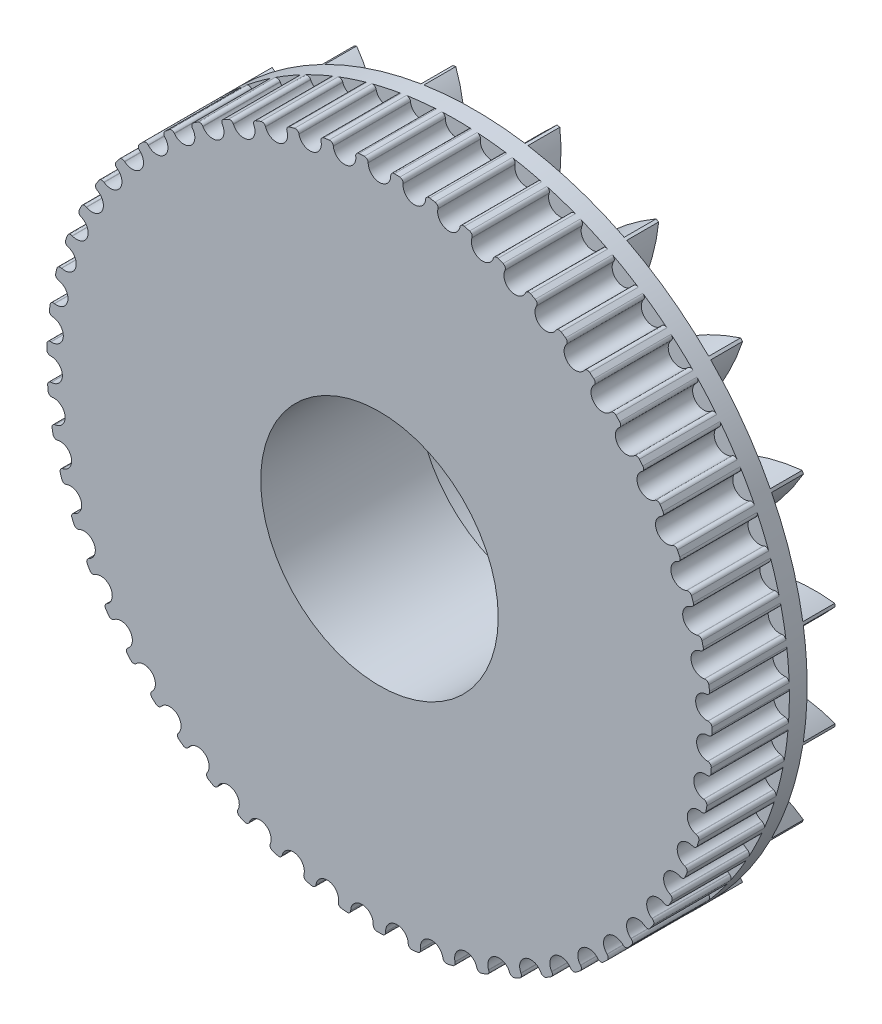
from build123d import *
from build123d.topology import SkipClean

# Parameters (mm, degrees)
KREISMUSTER1_COUNT              = 20
SKIZZE5_R                       = 28.00751142892637
AUFSATZ_LINEAR_AUSTRAGEN1_DEPTH = 8
SCHNITT_LINEAR_START            = -6.5
SCHNITT_LINEAR_AUSTRAGEN3_DEPTH = 6.5
VERRUNDUNG1_R                   = 0.3
KREISMUSTER4_COUNT              = 59
VERRUNDUNG1_OF_KREISMUSTER4_R   = 0.3
SKIZZE9_R                       = 10
SCHNITT_LINEAR_AUSTRAGEN4_DEPTH = 42.023846827976634
SKIZZE10_R                      = 14
SKIZZE10_R_2                    = 13.5
AUFSATZ_LINEAR_AUSTRAGEN2_DEPTH = 9.376581368
SKIZZE11_R                      = 13.5
SKIZZE11_R_2                    = 10
AUFSATZ_LINEAR_AUSTRAGEN4_DEPTH = 5.176581368
FASE1_SIZE                      = 0.5


with BuildPart() as part:
    # Skizze1 → Rotation1 (revolve)
    with BuildSketch(Plane(origin=(0, 0, 0), x_dir=(1, 0, 0), z_dir=(0, 1, 0)), mode=Mode.PRIVATE) as rotation1_sk:
        Polygon((-22.6426253353453, 0), (-28.007511428940546, 0), (-28.007511428940546, 2.6824430503504395), align=None)
    revolve(rotation1_sk.sketch.rotate(Axis((0, 0, 0), (0, 0, -1)), 180), axis=Axis((0, 0, 0), (0, 0, -1)))

    # Schnitt-Austragung1: sweep along a path in Skizze4
    with BuildLine(Plane(origin=(0, 0, 0), x_dir=(0, 0, -1), z_dir=(1, 0, 0))) as schnitt_austragung1_path:
        Line((1.1824430503504395, 23.6426253353453), (-4.817556949649561, 23.6426253353453))
    # Skizze3 → Schnitt-Austragung1 (sweep, cut)
    with BuildSketch(Plane(origin=(-2.8e-16, 4.528525076665702, 9.057050141335605), x_dir=(1, 1e-17, 2e-17), z_dir=(0, 0.4472135959738151, 0.8944271907629874))):
        with BuildLine():
            ThreePointArc((-1.4235874048946804, 21.11157284483264), (-2.7135842695253984, 24.03726069654396), (-4.861082261552092, 26.406225384049794))
            ThreePointArc((-4.861082261552092, 26.406225384049794), (4.8e-16, 26.817554770191748), (4.861082261552095, 26.406225384049797))
            ThreePointArc((4.861082261552095, 26.406225384049797), (2.7135842695254038, 24.037260696543967), (1.4235874048946822, 21.111572844832644))
            ThreePointArc((1.4235874048946822, 21.111572844832644), (1.2480505454885684, 20.851712010939014), (0.9482732653567925, 20.759655374465325))
            ThreePointArc((0.9482732653567925, 20.759655374465325), (1.45e-15, 20.779304770191747), (-0.9482732653567855, 20.759655374465325))
            ThreePointArc((-0.9482732653567855, 20.759655374465325), (-1.2480505454885633, 20.85171201093901), (-1.4235874048946804, 21.11157284483264))
        make_face()
    schnitt_austragung1 = sweep(path=schnitt_austragung1_path.line, mode=Mode.SUBTRACT)

    # Kreismuster1: Schnitt-Austragung1 ×20 about axis
    kreismuster1_axis = Axis((0, 0, 0), (0, 0, 1))
    for i in range(1, KREISMUSTER1_COUNT):
        add(schnitt_austragung1.rotate(kreismuster1_axis, i * 360 / KREISMUSTER1_COUNT), mode=Mode.SUBTRACT)

    # Skizze5 → Aufsatz-Linear austragen1 (add)
    with SkipClean():  # the faces are left unmerged after this step: merging them gives an invalid solid
        with BuildSketch(Plane.XY):
            Circle(SKIZZE5_R)
        extrude(amount=AUFSATZ_LINEAR_AUSTRAGEN1_DEPTH)

    # Skizze8 → Schnitt-Linear austragen3 (cut)
    with SkipClean():  # the faces are left unmerged after this step: merging them gives an invalid solid
        with BuildSketch(Plane.XY.offset(8).offset(SCHNITT_LINEAR_START)):
            with BuildLine():
                Line((-0.9499999999999998, 27.657511428926373), (-0.9499999999999998, 27.99139504278844))
                ThreePointArc((-0.9499999999999998, 27.99139504278844), (1.71e-15, 28.00751142892637), (0.9499999999999998, 27.99139504278844))
                Line((0.9499999999999998, 27.99139504278844), (0.9499999999999998, 27.657511428926373))
                ThreePointArc((0.9499999999999998, 27.657511428926373), (-1.7e-16, 26.707511428926374), (-0.9499999999999998, 27.657511428926373))
            make_face()
        schnitt_linear_austragen3 = extrude(amount=SCHNITT_LINEAR_AUSTRAGEN3_DEPTH, mode=Mode.SUBTRACT)

    # Verrundung1
    verrundung1_edges = [part.edges().sort_by_distance(p)[0] for p in [
        (0.9500000000000001, 27.99139504278844, 4.75),
        (-0.9500000000000001, 27.991395042788444, 4.75),
    ]]
    fillet(verrundung1_edges, radius=VERRUNDUNG1_R)

    # Kreismuster4: Schnitt-Linear austragen3 ×59 about axis
    with SkipClean():  # the faces are left unmerged after this step: merging them gives an invalid solid
        kreismuster4_axis = Axis((-2e-17, -1.4e-16, 0), (0, 0, 1))
        for i in range(1, KREISMUSTER4_COUNT):
            add(schnitt_linear_austragen3.rotate(kreismuster4_axis, i * 360 / KREISMUSTER4_COUNT), mode=Mode.SUBTRACT)

    # Verrundung1 of Kreismuster4
    verrundung1_of_kreismuster4_edges = [part.edges().sort_by_distance(p)[0] for p in [
        (-2.0306848870307377, 27.93379700883906, 4.75),
        (-3.919921007429999, 27.731839386109073, 4.75),
        (-4.988361302870907, 27.559697893000596, 4.75),
        (-6.845427743524855, 27.15807090810431, 4.75),
        (-7.889517591901509, 26.8733363877379, 4.75),
        (-9.693373047991434, 26.2765906348962, 4.75),
        (-10.70128249412459, 25.882489243161757, 4.75),
        (-12.431488562548925, 25.097386090201837, 4.75),
        (-13.391797589673713, 24.59838315334263, 4.75),
        (-15.028750344321946, 23.633818132698835, 4.75),
        (-15.930578267441028, 23.035567553380943, 4.75),
        (-17.455730379509863, 21.90246957215779, 4.75),
        (-18.288859127902143, 21.211749768493682, 4.75),
        (-19.684930014541973, 19.922957279581414, 4.75),
        (-20.43991990658681, 19.147594382944234, 4.75),
        (-21.691091526810382, 17.717709920217573, 4.75),
        (-22.359388225352255, 16.866489102045517, 4.75),
        (-23.45148430475963, 15.311713827819997, 4.75),
        (-24.02551574116625, 14.394279760113532, 4.75),
        (-24.946162394798286, 12.732229899502808, 4.75),
        (-25.419424563523837, 11.758977476837106, 4.75),
        (-26.158190496923147, 10.008484718883322, 4.75),
        (-26.525321148490004, 8.990441280099112, 4.75),
        (-27.073835848435287, 7.171339407211303, 4.75),
        (-27.33067524586323, 6.120039791259548, 4.75),
        (-27.68272382162875, 4.252939954533758, 4.75),
        (-27.826361871917104, 3.1802958061411783, 4.75),
        (-27.97795547246797, 1.2863529927827533, 4.75),
        (-28.006764699112118, 0.2045177987575162, 4.749999999999999),
        (-27.95618570838035, -1.694808862377044, 4.749999999999999),
        (-27.86983969133083, -2.773577477007247, 4.749999999999999),
        (-27.617661189491766, -4.656767855914861, 4.749999999999999),
        (-27.417138263623865, -5.720247011692191, 4.749999999999999),
        (-26.96621753386875, -7.56596380889514, 4.749999999999999),
        (-26.653789704057456, -8.602103862039916, 4.75),
        (-26.0092358584332, -10.38943436871488, 4.75),
        (-25.58844305683009, -11.386495438404442, 4.75),
        (-24.75755914795827, -13.095188485729759, 4.75),
        (-24.233169125145785, -14.041873471639112, 4.75),
        (-23.22536939971828, -15.652568884629488, 4.75),
        (-22.603323704190498, -16.538151467592172, 4.75),
        (-21.430026935792736, -18.032599423617196, 4.75),
        (-20.717373593836864, -18.847045599107368, 4.75),
        (-19.391873703680393, -20.20831340567417, 4.75),
        (-18.59668736242259, -20.94239517308737, 4.75),
        (-17.13400279390577, -22.155059122012535, 4.75),
        (-16.265293232332823, -22.800459041599787, 4.749999999999999),
        (-14.681996786076045, -23.850779165786054, 4.749999999999999),
        (-13.749606830639323, -24.400184598569695, 4.749999999999999),
        (-12.063637888031838, -25.27626035132342, 4.749999999999999),
        (-11.078131889490566, -25.723446314218737, 4.75),
        (-9.308593152331122, -26.415351407199104, 4.75),
        (-8.281137287436968, -26.75525110456006, 4.75),
        (-6.448078336689388, -27.255145976592356, 4.75),
        (-5.390314090942131, -27.483908209030822, 4.75),
        (-3.514504216971577, -27.786128851467065, 4.75),
        (-2.438416481936706, -27.901161651480763, 4.749999999999999),
        (-0.5411093601508582, -28.002283783680905, 4.749999999999999),
        (0.5411093601508389, -28.0022837836809, 4.749999999999999),
        (2.438416481936687, -27.901161651480766, 4.749999999999999),
        (3.5145042169715692, -27.786128851467062, 4.75),
        (5.390314090942125, -27.483908209030826, 4.75),
        (6.448078336689369, -27.25514597659236, 4.75),
        (8.28113728743695, -26.75525110456007, 4.75),
        (9.308593152331104, -26.415351407199104, 4.75),
        (11.07813188949055, -25.723446314218744, 4.75),
        (12.063637888031842, -25.276260351323412, 4.75),
        (13.749606830639328, -24.400184598569695, 4.75),
        (14.681996786076036, -23.850779165786054, 4.75),
        (16.265293232332816, -22.800459041599794, 4.75),
        (17.13400279390575, -22.155059122012542, 4.75),
        (18.596687362422575, -20.942395173087387, 4.75),
        (19.391873703680385, -20.208313405674172, 4.75),
        (20.71737359383686, -18.84704559910737, 4.75),
        (21.43002693579274, -18.03259942361719, 4.75),
        (22.603323704190505, -16.538151467592172, 4.75),
        (23.225369399718275, -15.652568884629494, 4.75),
        (24.233169125145785, -14.041873471639121, 4.75),
        (24.75755914795826, -13.095188485729762, 4.75),
        (25.58844305683009, -11.386495438404449, 4.75),
        (26.009235858433193, -10.389434368714891, 4.75),
        (26.653789704057456, -8.60210386203993, 4.75),
        (26.96621753386875, -7.5659638088951215, 4.75),
        (27.417138263623873, -5.720247011692173, 4.75),
        (27.617661189491756, -4.6567678559148735, 4.749999999999999),
        (27.869839691330835, -2.77357747700726, 4.749999999999999),
        (27.956185708380342, -1.6948088623770632, 4.75),
        (28.006764699112118, 0.2045177987574966, 4.75),
        (27.977955472467965, 1.2863529927827646, 4.75),
        (27.826361871917108, 3.18029580614119, 4.75),
        (27.68272382162875, 4.252939954533738, 4.75),
        (27.330675245863237, 6.120039791259529, 4.75),
        (27.07383584843529, 7.171339407211289, 4.75),
        (26.525321148490015, 8.9904412800991, 4.75),
        (26.15819049692314, 10.008484718883327, 4.75),
        (25.419424563523837, 11.75897747683711, 4.75),
        (24.946162394798293, 12.732229899502787, 4.75),
        (24.025515741166263, 14.394279760113516, 4.75),
        (23.451484304759628, 15.31171382782, 4.75),
        (22.359388225352255, 16.86648910204552, 4.75),
        (21.691091526810396, 17.717709920217555, 4.75),
        (20.439919906586827, 19.14759438294422, 4.75),
        (19.684930014541987, 19.922957279581397, 4.75),
        (18.28885912790216, 21.21174976849367, 4.75),
        (17.45573037950986, 21.90246957215779, 4.75),
        (15.930578267441032, 23.035567553380943, 4.75),
        (15.028750344321967, 23.63381813269882, 4.75),
        (13.391797589673738, 24.59838315334262, 4.75),
        (12.431488562548925, 25.097386090201834, 4.75),
        (10.701282494124593, 25.882489243161757, 4.75),
        (9.693373047991436, 26.276590634896195, 4.75),
        (7.889517591901512, 26.873336387737904, 4.75),
        (6.8454277435248825, 27.1580709081043, 4.75),
        (4.988361302870937, 27.559697893000592, 4.75),
        (3.919921007430004, 27.73183938610907, 4.75),
        (2.0306848870307435, 27.933797008839065, 4.75),
    ]]
    fillet(verrundung1_of_kreismuster4_edges, radius=VERRUNDUNG1_OF_KREISMUSTER4_R)

    # Skizze9 → Schnitt-Linear austragen4 (cut, through all)
    with SkipClean():  # the faces are left unmerged after this step: merging them gives an invalid solid
        with BuildSketch(Plane.XY.offset(8)):
            Circle(SKIZZE9_R)
        extrude(amount=-SCHNITT_LINEAR_AUSTRAGEN4_DEPTH, mode=Mode.SUBTRACT)

    # Skizze10 → Aufsatz-Linear austragen2 (add)
    with SkipClean():  # the faces are left unmerged after this step: merging them gives an invalid solid
        with BuildSketch(Plane(origin=(0, 0, 0), x_dir=(-1, 0, 0), z_dir=(0, 0, -1))):
            with Locations(Location((0, 0, 0), (0, 0, 180))):
                Circle(SKIZZE10_R)
            with Locations(Location((0, 0, 0), (0, 0, 180))):
                Circle(SKIZZE10_R_2, mode=Mode.SUBTRACT)
        extrude(amount=AUFSATZ_LINEAR_AUSTRAGEN2_DEPTH)

    # Skizze11 → Aufsatz-Linear austragen4 (add)
    with SkipClean():  # the faces are left unmerged after this step: merging them gives an invalid solid
        with BuildSketch(Plane(origin=(0, 0, 0), x_dir=(-1, 0, 0), z_dir=(0, 0, -1))):
            with Locations(Location((0, 0, 0), (0, 0, 180))):
                Circle(SKIZZE11_R)
            with Locations(Location((0, 0, 0), (0, 0, 180))):
                Circle(SKIZZE11_R_2, mode=Mode.SUBTRACT)
        extrude(amount=AUFSATZ_LINEAR_AUSTRAGEN4_DEPTH)

    # Fase1
    fase1_edges = [part.edges().sort_by_distance(p)[0] for p in [
        (-13.5, -3.31e-15, -9.376581368),
    ]]
    chamfer(fase1_edges, length=FASE1_SIZE - 0.0001)  # a hair under: the kernel refuses the full size


solid = part.part
